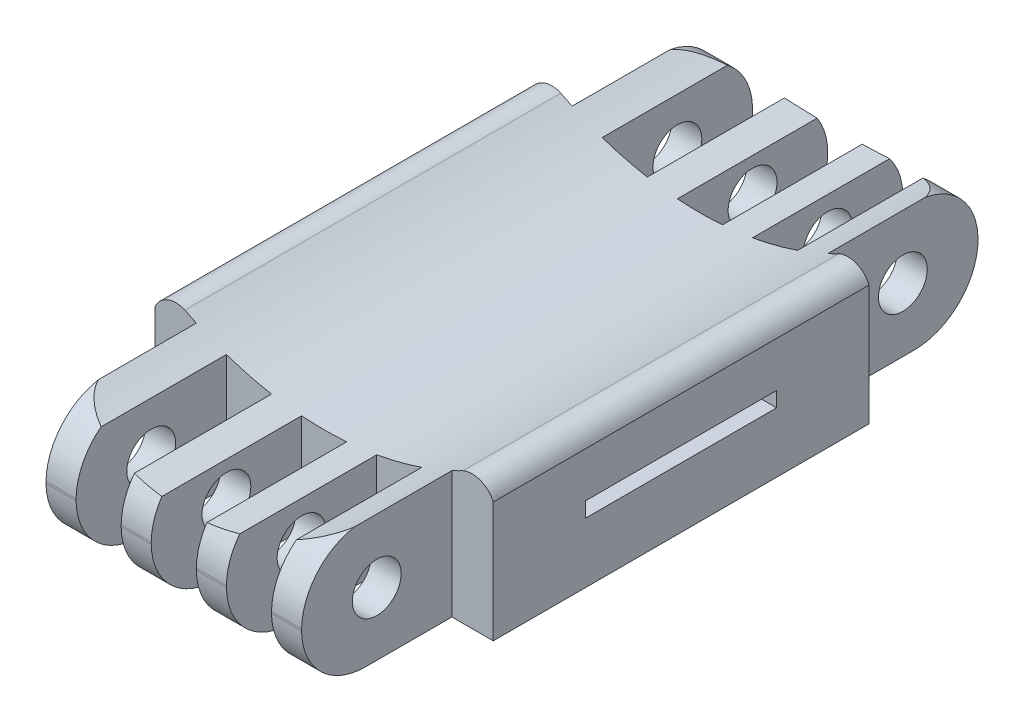
from build123d import *

# Parameters (mm, degrees)
BOSS_EXTRUDE1_DEPTH = 20
CUT_EXTRUDE21_DEPTH = 45
CUT_EXTRUDE23_DEPTH = 444
SKETCH9_R           = 3.25
SKETCH9_R_2         = 3.15
CUT_EXTRUDE24_DEPTH = 45
CUT_EXTRUDE26_DEPTH = 444
CUT_EXTRUDE27_DEPTH = 45


with BuildPart() as part:
    # Sketch1 → Boss-Extrude1 (new body)
    with BuildSketch(Plane(origin=(0, 0, 0), x_dir=(1, 0, 0), z_dir=(0, 1, 0))):
        Polygon((-17, 94), (-17, 74), (-15, 74), (-13, 74), (-13, 94), (-12.5, 94), (-7.5, 94), (-7, 94), (-7, 74), (-5, 74), (-3, 74), (-3, 94), (-2.5, 94), (2.5, 94), (3, 94), (3, 74), (5, 74), (7, 74), (7, 94), (7.5, 94), (12.5, 94), (13, 94), (13, 74), (17, 74), (17, 94), (17.5, 94), (22.5, 94), (22.5, 144), (17.5, 144), (17, 144), (17, 164), (15, 164), (13, 164), (13, 144), (12.5, 144), (7.5, 144), (7, 144), (7, 164), (5, 164), (3, 164), (3, 144), (2.5, 144), (-2.5, 144), (-3, 144), (-3, 164), (-5, 164), (-7, 164), (-7, 144), (-7.5, 144), (-12.5, 144), (-13, 144), (-13, 164), (-15, 164), (-17, 164), (-17, 144), (-17.5, 144), (-22.5, 144), (-22.5, 94), (-17.5, 94), align=None)
    extrude(amount=BOSS_EXTRUDE1_DEPTH)

    # Sketch7 → Cut-Extrude21 (cut)
    with BuildSketch(Plane(origin=(22.5, 0, 0), x_dir=(0, 0, -1), z_dir=(1, 0, 0))):
        with BuildLine():
            ThreePointArc((73.999126156, 8.5), (76.488718516, 14.51040764), (82.499126156, 17))
            Line((82.499126156, 17), (93.999126156, 17))
            Line((93.999126156, 17), (93.999126156, 20))
            Line((93.999126156, 20), (73.999126156, 20))
            Line((73.999126156, 20), (73.999126156, 8.5))
        make_face()
        with BuildLine():
            ThreePointArc((82.499126156, 0), (76.488718516, 2.48959236), (73.999126156, 8.5))
            Line((73.999126156, 8.5), (73.999126156, 0))
            Line((73.999126156, 0), (82.499126156, 0))
        make_face()
        with BuildLine():
            ThreePointArc((155.499126156, 17), (163.999126156, 8.5), (155.499126156, 0))
            Line((155.499126156, 0), (164.814039075, 0))
            Line((164.814039075, 0), (164.814039075, 20))
            Line((164.814039075, 20), (143.999126156, 20))
            Line((143.999126156, 20), (143.999126156, 17))
            Line((143.999126156, 17), (155.499126156, 17))
        make_face()
    extrude(amount=-CUT_EXTRUDE21_DEPTH, mode=Mode.SUBTRACT)

    # Sketch2 → Cut-Extrude23 (cut)
    with BuildSketch(Plane.XY.offset(50)):
        with BuildLine():
            Line((-22.5, 20), (22.5, 20))
            Line((22.5, 20), (22.5, 16))
            ThreePointArc((22.5, 16), (20.832845478, 17.631987193), (18.5, 17.607120136))
            ThreePointArc((18.5, 17.607120136), (0, 13.071891388), (-18.5, 17.607120136))
            ThreePointArc((-18.5, 17.607120136), (-20.832845478, 17.631987193), (-22.5, 16))
            Line((-22.5, 16), (-22.5, 20))
        make_face()
    extrude(amount=-CUT_EXTRUDE23_DEPTH, mode=Mode.SUBTRACT)

    # Sketch9 → Cut-Extrude24 (cut)
    with BuildSketch(Plane(origin=(22.5, 0, 0), x_dir=(0, 0, -1), z_dir=(1, 0, 0))):
        with Locations((153.999563078, 8.466039352)):
            Circle(SKETCH9_R)
        with Locations((84, 8.405099657)):
            Circle(SKETCH9_R)
        with Locations((178, 8.5)):
            Circle(SKETCH9_R_2)
        with Locations((60, 8.5)):
            Circle(SKETCH9_R_2)
    extrude(amount=-CUT_EXTRUDE24_DEPTH, mode=Mode.SUBTRACT)

    # Sketch12 → Cut-Extrude26 (cut)
    with BuildSketch(Plane.XY.offset(50)):
        Polygon((-1, 3.35), (-1, 6.55), (0, 6.55), (1, 6.55), (1, 3.35), align=None)
    extrude(amount=-CUT_EXTRUDE26_DEPTH, mode=Mode.SUBTRACT)

    # Sketch13 → Cut-Extrude27 (cut)
    with BuildSketch(Plane(origin=(22.5, 0, 0), x_dir=(0, 0, -1), z_dir=(1, 0, 0))):
        Polygon((119, 8), (131.7, 8), (131.7, 10), (106.3, 10), (106.3, 8), align=None)
    extrude(amount=-CUT_EXTRUDE27_DEPTH, mode=Mode.SUBTRACT)


solid = part.part
